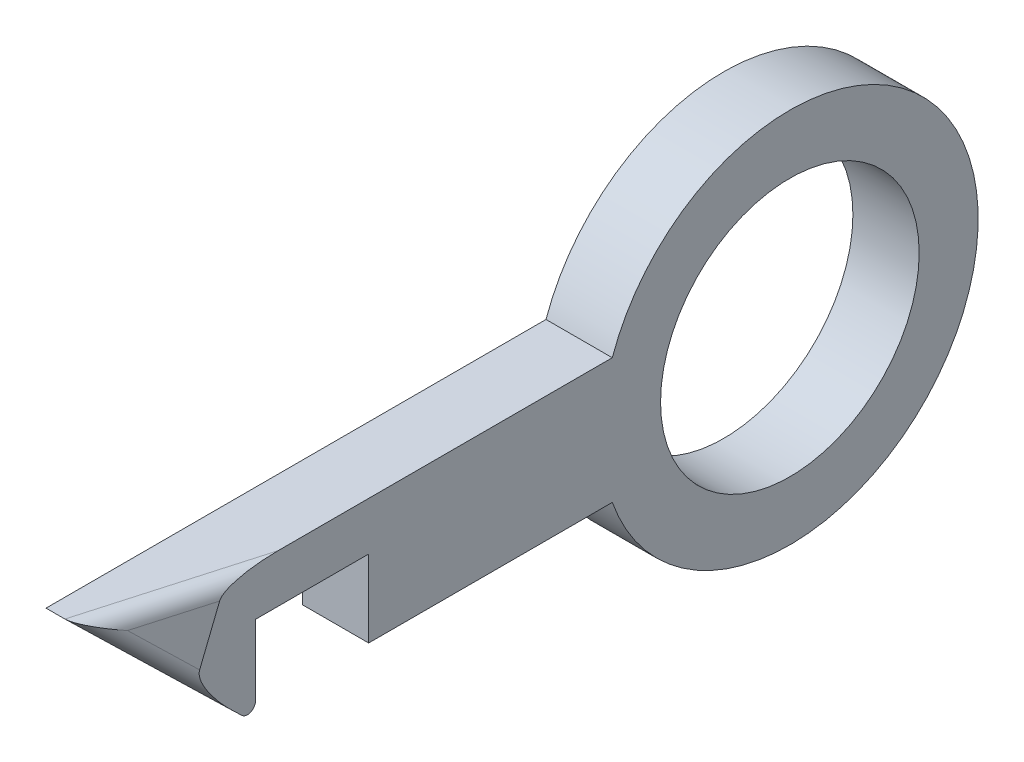
from build123d import *

# Parameters (mm, degrees)
SKETCH1_R           = 8
BOSS_EXTRUDE1_DEPTH = 4.1
FILLET1_R           = 0.5
CHAMFER1_START      = 5.365714371
CHAMFER1_OUTLINE_W  = 7
CHAMFER1_OUTLINE_H  = 10
CHAMFER1_DEPTH      = 2.634285629
FILLET2_R           = 1


with BuildPart() as part:
    # Sketch1 → Boss-Extrude1 (new body)
    with BuildSketch(Plane(origin=(0, 0, 0), x_dir=(0, 0, -1), z_dir=(1, 0, 0))):
        with BuildLine():
            Line((-0.008202263, 0.000360071), (-8.869837301, 8.519305154))
            Line((-8.869837301, 8.519305154), (22.061371293, 8.519305154))
            ThreePointArc((22.061371293, 8.519305154), (44.698252536, 4.645550739), (22.061797737, 0.769305154))
            Line((22.061797737, 0.769305154), (6.991797737, 0.769305154))
            Line((6.991797737, 0.769305154), (6.991797737, 5.53817988))
            Line((6.991797737, 5.53817988), (-0.008202263, 5.53817988))
            Line((-0.008202263, 5.53817988), (-0.008202263, 0.000360071))
        make_face()
        with Locations((33.048252553, 4.644909697)):
            Circle(SKETCH1_R, mode=Mode.SUBTRACT)
    extrude(amount=BOSS_EXTRUDE1_DEPTH)

    # Fillet1
    fillet1_edges = [part.edges().sort_by_distance(p)[0] for p in [
        (2.05, 0.000360071, 0.008202263),
    ]]
    fillet(fillet1_edges, radius=FILLET1_R)

    # Chamfer1: read off the stored shape, not the designer's step
    # Chamfer1 outline → Chamfer1 (cut)
    with BuildSketch(Plane(origin=(0, 0, 0), x_dir=(-0.10573160402996473, 0.993935733552454, -0.03020902972284707), z_dir=(0.955693010226633, 0.10996252801543402, 0.273055145779038)).offset(CHAMFER1_START)):
        with Locations((5.5, 4)):
            Rectangle(CHAMFER1_OUTLINE_W, CHAMFER1_OUTLINE_H)
    extrude(amount=CHAMFER1_DEPTH, mode=Mode.SUBTRACT)

    # Fillet2
    fillet2_edges = [part.edges().sort_by_distance(p)[0] for p in [
        (3.1, 8.519305154, 5.369837302),
        (3.1, 6.093699523, 6.346657301),
    ]]
    fillet(fillet2_edges, radius=FILLET2_R)


solid = part.part
